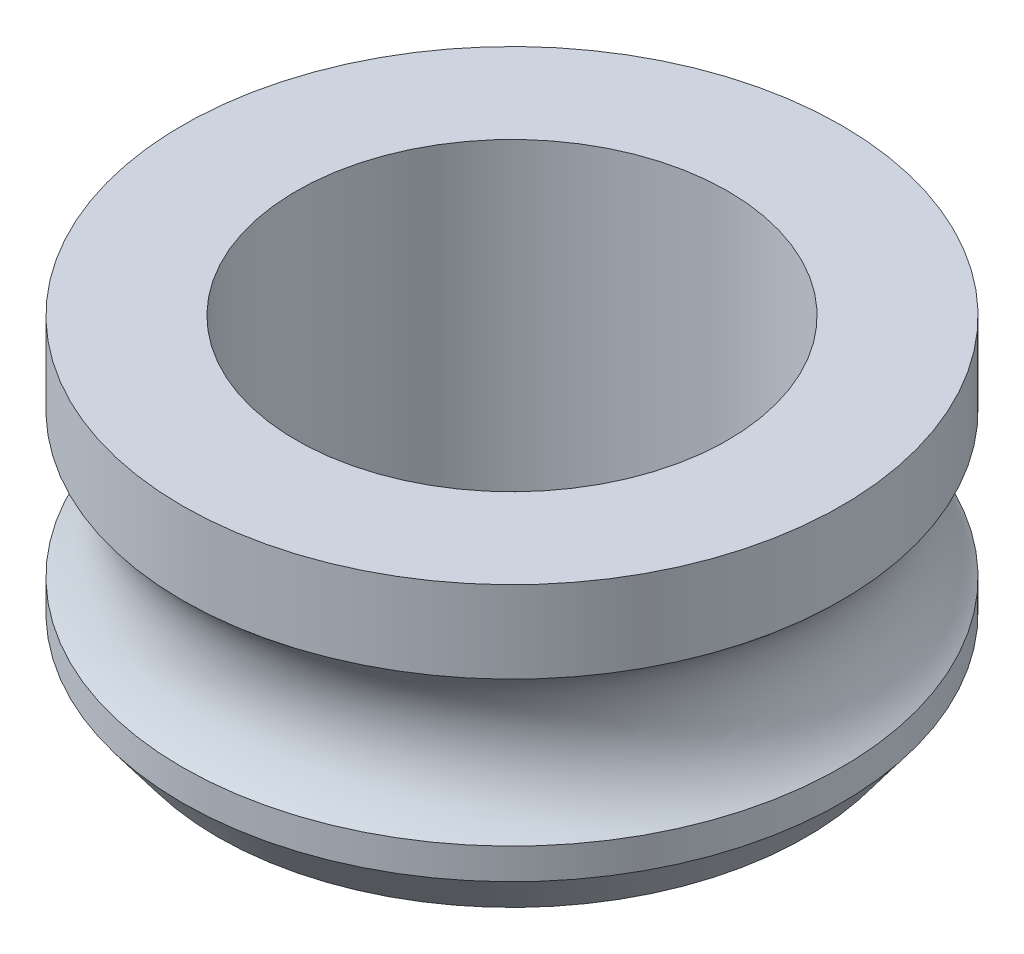
from build123d import *

# Parameters (mm, degrees)
SKETCH1_R           = 27.8
SKETCH1_R_2         = 18.2
BOSS_EXTRUDE1_DEPTH = 25.7


with BuildPart() as part:
    # Sketch1 → Boss-Extrude1 (new body)
    with BuildSketch(Plane(origin=(0, 0, 0), x_dir=(1, 0, 0), z_dir=(0, 1, 0))):
        Circle(SKETCH1_R)
        Circle(SKETCH1_R_2, mode=Mode.SUBTRACT)
    extrude(amount=BOSS_EXTRUDE1_DEPTH)

    # Sketch2 → Cut-Revolve1 (revolve, cut)
    with BuildSketch(Plane.XY):
        with BuildLine():
            ThreePointArc((27.8, 18.799180273), (24.8, 12.7), (27.8, 6.600819727))
            Line((27.8, 6.600819727), (27.8, 18.799180273))
        make_face()
        Polygon((24.8, 0), (27.8, 0), (27.8, 4), align=None)
    revolve(axis=Axis((0, 25.7, 0), (0, -1, 0)), mode=Mode.SUBTRACT)


solid = part.part
